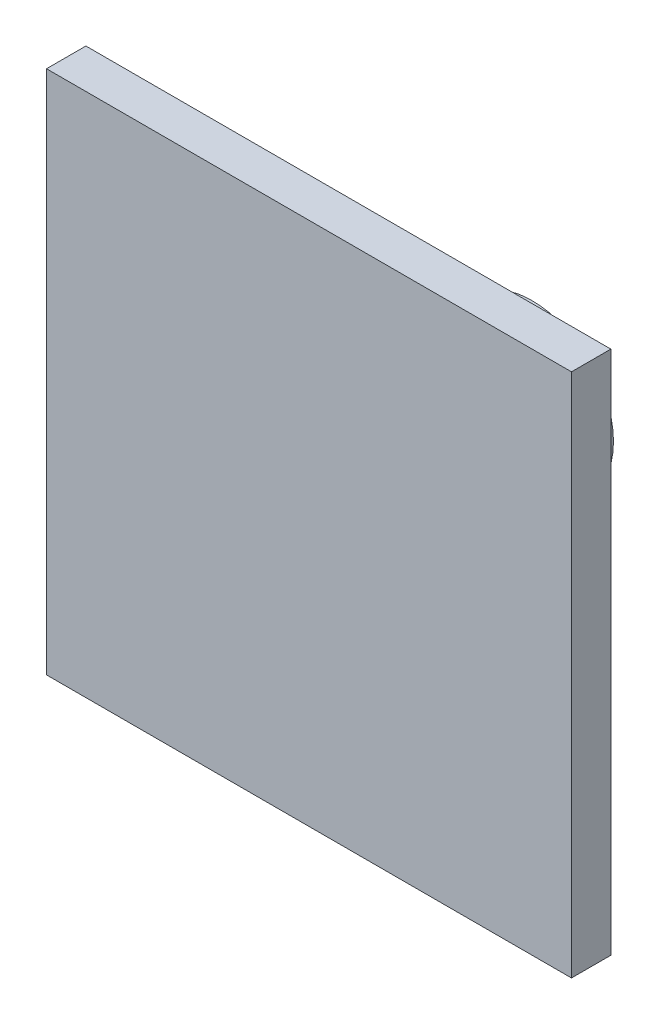
from build123d import *

# Parameters (mm, degrees)
SKETCH_2_W        = 20
SKETCH_2_H        = 20
EXTRUDE_351_DEPTH = 1.5
SKETCH_3_R        = 3.1
SKETCH_3_R_2      = 1.1
EXTRUDE_479_DEPTH = 7
CHAMFER_1_SIZE    = 2


with BuildPart() as part:
    # Эскиз2 → Extrude 351 (new body)
    with BuildSketch(Plane.XY):
        Rectangle(SKETCH_2_W, SKETCH_2_H)
    extrude(amount=EXTRUDE_351_DEPTH)

    # Эскиз3 → Extrude 479 (add)
    with BuildSketch(Plane.XY):
        Circle(SKETCH_3_R)
        Circle(SKETCH_3_R_2, mode=Mode.SUBTRACT)
    extrude(amount=-EXTRUDE_479_DEPTH)

    # Фаска1
    chamfer_1_edges = [part.edges().sort_by_distance(p)[0] for p in [
        (-3.1, 0, 0),
    ]]
    chamfer(chamfer_1_edges, length=CHAMFER_1_SIZE)


solid = part.part
